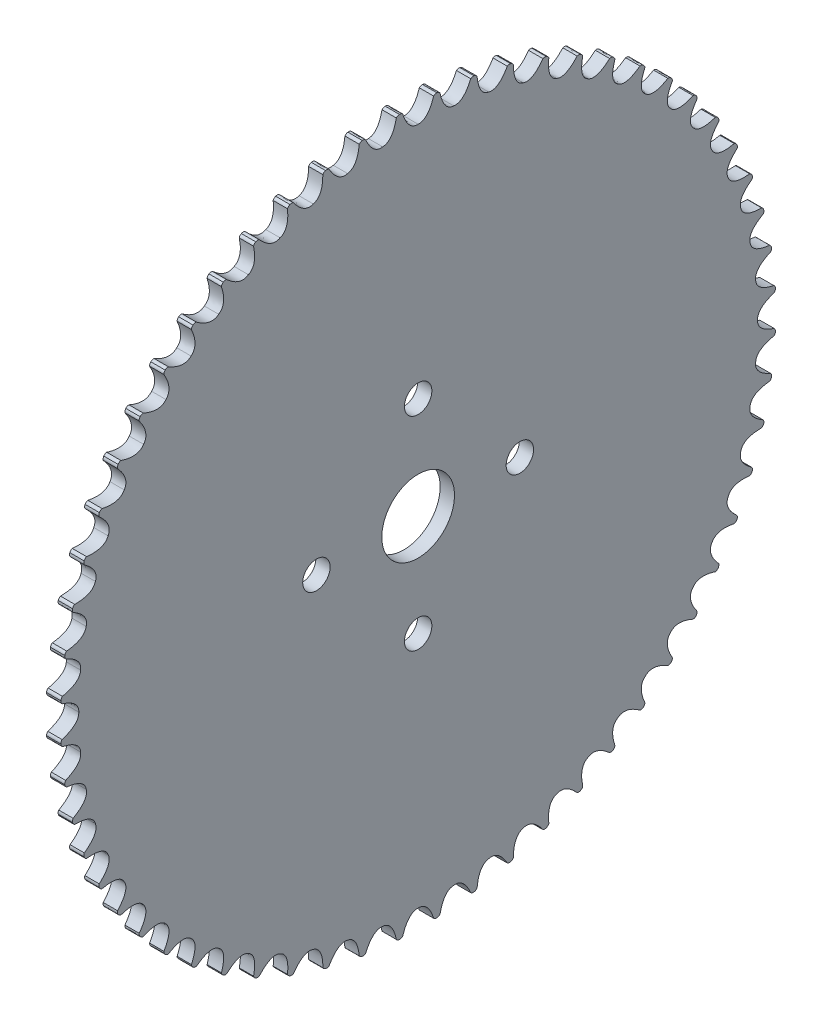
from build123d import *

# Parameters (mm, degrees)
BOSS_EXTRUDE1_DEPTH = 5
CUT_EXTRUDE3_DEPTH  = 5
SKETCH4_R           = 12.7
CUT_EXTRUDE4_DEPTH  = 5
SKETCH5_R           = 4.792551345
CUT_EXTRUDE5_DEPTH  = 5


with BuildPart() as part:
    # Sketch2 → Boss-Extrude1 (new body)
    with BuildSketch(Plane(origin=(0, 0, 0), x_dir=(0, 0, -1), z_dir=(1, 0, 0))):
        with BuildLine():
            Line((-20.522720764, 123.299339318), (-18.583323929, 123.6065096))
            add(Edge.make_bspline(
                [(-18.583323929, 123.6065096), (-17.5687314, 121.194366697), (-15.591895853, 117.421465463), (-12.393907976, 117.920157498)],
                knots=[0, 0, 0, 0, 1, 1, 1, 1], degree=3))
            add(Edge.make_bspline(
                [(-7.522004692, 124.7691011), (-8.012913231, 122.198723658), (-9.162119903, 118.097262147), (-12.393907976, 117.920157498)],
                knots=[0, 0, 0, 0, 1, 1, 1, 1], degree=3))
            Line((-7.522004692, 124.7691011), (-5.561124038, 124.8718665))
            add(Edge.make_bspline(
                [(-5.561124038, 124.8718665), (-4.804227144, 122.36688377), (-3.232596477, 118.408015302), (0, 118.569694692)],
                knots=[0, 0, 0, 0, 1, 1, 1, 1], degree=3))
            add(Edge.make_bspline(
                [(5.561124038, 124.8718665), (4.804227144, 122.36688377), (3.232596477, 118.408015302), (0, 118.569694692)],
                knots=[0, 0, 0, 0, 1, 1, 1, 1], degree=3))
            Line((5.561124038, 124.8718665), (7.522004692, 124.7691011))
            add(Edge.make_bspline(
                [(7.522004692, 124.7691011), (8.012913231, 122.198723658), (9.162119903, 118.097262147), (12.393907976, 117.920157498)],
                knots=[0, 0, 0, 0, 1, 1, 1, 1], degree=3))
            add(Edge.make_bspline(
                [(18.583323929, 123.6065096), (17.5687314, 121.194366697), (15.591895853, 117.421465463), (12.393907976, 117.920157498)],
                knots=[0, 0, 0, 0, 1, 1, 1, 1], degree=3))
            Line((18.583323929, 123.6065096), (20.522720764, 123.299339318))
            add(Edge.make_bspline(
                [(20.522720764, 123.299339318), (20.742262451, 120.691728758), (21.45645418, 116.492610675), (24.652025703, 115.978662382)],
                knots=[0, 0, 0, 0, 1, 1, 1, 1], degree=3))
            add(Edge.make_bspline(
                [(31.401921035, 120.986893915), (30.140748959, 118.694018781), (27.780367156, 115.148421476), (24.652025703, 115.978662382)],
                knots=[0, 0, 0, 0, 1, 1, 1, 1], degree=3))
            Line((31.401921035, 120.986893915), (33.298585614, 120.478684172))
            add(Edge.make_bspline(
                [(33.298585614, 120.478684172), (33.244355103, 117.862410021), (33.515707055, 113.611641782), (36.640050678, 112.766480772)],
                knots=[0, 0, 0, 0, 1, 1, 1, 1], degree=3))
            add(Edge.make_bspline(
                [(43.876472122, 117.041720501), (42.382538164, 114.893234356), (39.664470943, 111.613787288), (36.640050678, 112.766480772)],
                knots=[0, 0, 0, 0, 1, 1, 1, 1], degree=3))
            Line((43.876472122, 117.041720501), (45.709624191, 116.338039352))
            add(Edge.make_bspline(
                [(45.709624191, 116.338039352), (45.382215644, 113.741766055), (45.20775483, 109.485919967), (48.226639589, 108.318806)],
                knots=[0, 0, 0, 0, 1, 1, 1, 1], degree=3))
            add(Edge.make_bspline(
                [(55.870303399, 111.814213506), (54.159975413, 109.833655613), (51.114002485, 106.856289089), (48.226639589, 108.318806)],
                knots=[0, 0, 0, 0, 1, 1, 1, 1], degree=3))
            Line((55.870303399, 111.814213506), (57.61985856, 110.922770626))
            add(Edge.make_bspline(
                [(57.61985856, 110.922770626), (57.022859133, 108.374943499), (56.404496982, 104.160647502), (59.284847346, 102.684367722)],
                knots=[0, 0, 0, 0, 1, 1, 1, 1], degree=3))
            add(Edge.make_bspline(
                [(67.252007941, 105.361646588), (65.344024637, 103.570716355), (62.00351832, 100.928051025), (59.284847346, 102.684367722)],
                knots=[0, 0, 0, 0, 1, 1, 1, 1], degree=3))
            Line((67.252007941, 105.361646588), (68.8987977, 104.292208814))
            add(Edge.make_bspline(
                [(68.8987977, 104.292208814), (68.038748245, 101.820742382), (66.983259662, 97.694169186), (69.693517909, 95.924898023)],
                knots=[0, 0, 0, 0, 1, 1, 1, 1], degree=3))
            add(Edge.make_bspline(
                [(77.89688541, 97.754715422), (75.812151053, 96.173034655), (72.213710634, 93.894024114), (69.693517909, 95.924898023)],
                knots=[0, 0, 0, 0, 1, 1, 1, 1], degree=3))
            Line((77.89688541, 97.754715422), (79.422867196, 96.518999737))
            add(Edge.make_bspline(
                [(79.422867196, 96.518999737), (78.309190593, 94.150971905), (76.828139732, 90.157333108), (79.338611705, 88.114455068)],
                knots=[0, 0, 0, 0, 1, 1, 1, 1], degree=3))
            add(Edge.make_bspline(
                [(87.688308301, 89.076763138), (85.449663678, 87.721661062), (81.632714422, 85.831274626), (79.338611705, 88.114455068)],
                knots=[0, 0, 0, 0, 1, 1, 1, 1], degree=3))
            Line((87.688308301, 89.076763138), (89.076763138, 87.688308301))
            add(Edge.make_bspline(
                [(89.076763138, 87.688308301), (87.721661062, 85.449663678), (85.831274626, 81.632714422), (88.114455068, 79.338611705)],
                knots=[0, 0, 0, 0, 1, 1, 1, 1], degree=3))
            add(Edge.make_bspline(
                [(96.518999737, 79.422867196), (94.150971905, 78.309190593), (90.157333108, 76.828139732), (88.114455068, 79.338611705)],
                knots=[0, 0, 0, 0, 1, 1, 1, 1], degree=3))
            Line((96.518999737, 79.422867196), (97.754715422, 77.89688541))
            add(Edge.make_bspline(
                [(97.754715422, 77.89688541), (96.173034655, 75.812151053), (93.894024114, 72.213710634), (95.924898023, 69.693517909)],
                knots=[0, 0, 0, 0, 1, 1, 1, 1], degree=3))
            add(Edge.make_bspline(
                [(104.292208814, 68.8987977), (101.820742382, 68.038748245), (97.694169186, 66.983259662), (95.924898023, 69.693517909)],
                knots=[0, 0, 0, 0, 1, 1, 1, 1], degree=3))
            Line((104.292208814, 68.8987977), (105.361646588, 67.252007941))
            add(Edge.make_bspline(
                [(105.361646588, 67.252007941), (103.570716355, 65.344024637), (100.928051025, 62.00351832), (102.684367722, 59.284847346)],
                knots=[0, 0, 0, 0, 1, 1, 1, 1], degree=3))
            add(Edge.make_bspline(
                [(110.922770626, 57.61985856), (108.374943499, 57.022859133), (104.160647502, 56.404496982), (102.684367722, 59.284847346)],
                knots=[0, 0, 0, 0, 1, 1, 1, 1], degree=3))
            Line((110.922770626, 57.61985856), (111.814213506, 55.870303399))
            add(Edge.make_bspline(
                [(111.814213506, 55.870303399), (109.833655613, 54.159975413), (106.856289089, 51.114002485), (108.318806, 48.226639589)],
                knots=[0, 0, 0, 0, 1, 1, 1, 1], degree=3))
            add(Edge.make_bspline(
                [(116.338039352, 45.709624191), (113.741766055, 45.382215644), (109.485919967, 45.20775483), (108.318806, 48.226639589)],
                knots=[0, 0, 0, 0, 1, 1, 1, 1], degree=3))
            Line((116.338039352, 45.709624191), (117.041720501, 43.876472122))
            add(Edge.make_bspline(
                [(117.041720501, 43.876472122), (114.893234356, 42.382538164), (111.613787288, 39.664470943), (112.766480772, 36.640050678)],
                knots=[0, 0, 0, 0, 1, 1, 1, 1], degree=3))
            add(Edge.make_bspline(
                [(120.478684172, 33.298585614), (117.862410021, 33.244355103), (113.611641782, 33.515707055), (112.766480772, 36.640050678)],
                knots=[0, 0, 0, 0, 1, 1, 1, 1], degree=3))
            Line((120.478684172, 33.298585614), (120.986893915, 31.401921035))
            add(Edge.make_bspline(
                [(120.986893915, 31.401921035), (118.694018781, 30.140748959), (115.148421476, 27.780367156), (115.978662382, 24.652025703)],
                knots=[0, 0, 0, 0, 1, 1, 1, 1], degree=3))
            add(Edge.make_bspline(
                [(123.299339318, 20.522720764), (120.691728758, 20.742262451), (116.492610675, 21.45645418), (115.978662382, 24.652025703)],
                knots=[0, 0, 0, 0, 1, 1, 1, 1], degree=3))
            Line((123.299339318, 20.522720764), (123.6065096, 18.583323929))
            add(Edge.make_bspline(
                [(123.6065096, 18.583323929), (121.194366697, 17.5687314), (117.421465463, 15.591895853), (117.920157498, 12.393907976)],
                knots=[0, 0, 0, 0, 1, 1, 1, 1], degree=3))
            add(Edge.make_bspline(
                [(124.7691011, 7.522004692), (122.198723658, 8.012913231), (118.097262147, 9.162119903), (117.920157498, 12.393907976)],
                knots=[0, 0, 0, 0, 1, 1, 1, 1], degree=3))
            Line((124.7691011, 7.522004692), (124.8718665, 5.561124038))
            add(Edge.make_bspline(
                [(124.8718665, 5.561124038), (122.36688377, 4.804227144), (118.408015302, 3.232596477), (118.569694692, 0)],
                knots=[0, 0, 0, 0, 1, 1, 1, 1], degree=3))
            add(Edge.make_bspline(
                [(124.8718665, -5.561124038), (122.36688377, -4.804227144), (118.408015302, -3.232596477), (118.569694692, 0)],
                knots=[0, 0, 0, 0, 1, 1, 1, 1], degree=3))
            Line((124.8718665, -5.561124038), (124.7691011, -7.522004692))
            add(Edge.make_bspline(
                [(124.7691011, -7.522004692), (122.198723658, -8.012913231), (118.097262147, -9.162119903), (117.920157498, -12.393907976)],
                knots=[0, 0, 0, 0, 1, 1, 1, 1], degree=3))
            add(Edge.make_bspline(
                [(123.6065096, -18.583323929), (121.194366697, -17.5687314), (117.421465463, -15.591895853), (117.920157498, -12.393907976)],
                knots=[0, 0, 0, 0, 1, 1, 1, 1], degree=3))
            Line((123.6065096, -18.583323929), (123.299339318, -20.522720764))
            add(Edge.make_bspline(
                [(123.299339318, -20.522720764), (120.691728758, -20.742262451), (116.492610675, -21.45645418), (115.978662382, -24.652025703)],
                knots=[0, 0, 0, 0, 1, 1, 1, 1], degree=3))
            add(Edge.make_bspline(
                [(120.986893915, -31.401921035), (118.694018781, -30.140748959), (115.148421476, -27.780367156), (115.978662382, -24.652025703)],
                knots=[0, 0, 0, 0, 1, 1, 1, 1], degree=3))
            Line((120.986893915, -31.401921035), (120.478684172, -33.298585614))
            add(Edge.make_bspline(
                [(120.478684172, -33.298585614), (117.862410021, -33.244355103), (113.611641782, -33.515707055), (112.766480772, -36.640050678)],
                knots=[0, 0, 0, 0, 1, 1, 1, 1], degree=3))
            add(Edge.make_bspline(
                [(117.041720501, -43.876472122), (114.893234356, -42.382538164), (111.613787288, -39.664470943), (112.766480772, -36.640050678)],
                knots=[0, 0, 0, 0, 1, 1, 1, 1], degree=3))
            Line((117.041720501, -43.876472122), (116.338039352, -45.709624191))
            add(Edge.make_bspline(
                [(116.338039352, -45.709624191), (113.741766055, -45.382215644), (109.485919967, -45.20775483), (108.318806, -48.226639589)],
                knots=[0, 0, 0, 0, 1, 1, 1, 1], degree=3))
            add(Edge.make_bspline(
                [(111.814213506, -55.870303399), (109.833655613, -54.159975413), (106.856289089, -51.114002485), (108.318806, -48.226639589)],
                knots=[0, 0, 0, 0, 1, 1, 1, 1], degree=3))
            Line((111.814213506, -55.870303399), (110.922770626, -57.61985856))
            add(Edge.make_bspline(
                [(110.922770626, -57.61985856), (108.374943499, -57.022859133), (104.160647502, -56.404496982), (102.684367722, -59.284847346)],
                knots=[0, 0, 0, 0, 1, 1, 1, 1], degree=3))
            add(Edge.make_bspline(
                [(105.361646588, -67.252007941), (103.570716355, -65.344024637), (100.928051025, -62.00351832), (102.684367722, -59.284847346)],
                knots=[0, 0, 0, 0, 1, 1, 1, 1], degree=3))
            Line((105.361646588, -67.252007941), (104.292208814, -68.8987977))
            add(Edge.make_bspline(
                [(104.292208814, -68.8987977), (101.820742382, -68.038748245), (97.694169186, -66.983259662), (95.924898023, -69.693517909)],
                knots=[0, 0, 0, 0, 1, 1, 1, 1], degree=3))
            add(Edge.make_bspline(
                [(97.754715422, -77.89688541), (96.173034655, -75.812151053), (93.894024114, -72.213710634), (95.924898023, -69.693517909)],
                knots=[0, 0, 0, 0, 1, 1, 1, 1], degree=3))
            Line((97.754715422, -77.89688541), (96.518999737, -79.422867196))
            add(Edge.make_bspline(
                [(96.518999737, -79.422867196), (94.150971905, -78.309190593), (90.157333108, -76.828139732), (88.114455068, -79.338611705)],
                knots=[0, 0, 0, 0, 1, 1, 1, 1], degree=3))
            add(Edge.make_bspline(
                [(89.076763138, -87.688308301), (87.721661062, -85.449663678), (85.831274626, -81.632714422), (88.114455068, -79.338611705)],
                knots=[0, 0, 0, 0, 1, 1, 1, 1], degree=3))
            Line((89.076763138, -87.688308301), (87.688308301, -89.076763138))
            add(Edge.make_bspline(
                [(87.688308301, -89.076763138), (85.449663678, -87.721661062), (81.632714422, -85.831274626), (79.338611705, -88.114455068)],
                knots=[0, 0, 0, 0, 1, 1, 1, 1], degree=3))
            add(Edge.make_bspline(
                [(79.422867196, -96.518999737), (78.309190593, -94.150971905), (76.828139732, -90.157333108), (79.338611705, -88.114455068)],
                knots=[0, 0, 0, 0, 1, 1, 1, 1], degree=3))
            Line((79.422867196, -96.518999737), (77.89688541, -97.754715422))
            add(Edge.make_bspline(
                [(77.89688541, -97.754715422), (75.812151053, -96.173034655), (72.213710634, -93.894024114), (69.693517909, -95.924898023)],
                knots=[0, 0, 0, 0, 1, 1, 1, 1], degree=3))
            add(Edge.make_bspline(
                [(68.8987977, -104.292208814), (68.038748245, -101.820742382), (66.983259662, -97.694169186), (69.693517909, -95.924898023)],
                knots=[0, 0, 0, 0, 1, 1, 1, 1], degree=3))
            Line((68.8987977, -104.292208814), (67.252007941, -105.361646588))
            add(Edge.make_bspline(
                [(67.252007941, -105.361646588), (65.344024637, -103.570716355), (62.00351832, -100.928051025), (59.284847346, -102.684367722)],
                knots=[0, 0, 0, 0, 1, 1, 1, 1], degree=3))
            add(Edge.make_bspline(
                [(57.61985856, -110.922770626), (57.022859133, -108.374943499), (56.404496982, -104.160647502), (59.284847346, -102.684367722)],
                knots=[0, 0, 0, 0, 1, 1, 1, 1], degree=3))
            Line((57.61985856, -110.922770626), (55.870303399, -111.814213506))
            add(Edge.make_bspline(
                [(55.870303399, -111.814213506), (54.159975413, -109.833655613), (51.114002485, -106.856289089), (48.226639589, -108.318806)],
                knots=[0, 0, 0, 0, 1, 1, 1, 1], degree=3))
            add(Edge.make_bspline(
                [(45.709624191, -116.338039352), (45.382215644, -113.741766055), (45.20775483, -109.485919967), (48.226639589, -108.318806)],
                knots=[0, 0, 0, 0, 1, 1, 1, 1], degree=3))
            Line((45.709624191, -116.338039352), (43.876472122, -117.041720501))
            add(Edge.make_bspline(
                [(43.876472122, -117.041720501), (42.382538164, -114.893234356), (39.664470943, -111.613787288), (36.640050678, -112.766480772)],
                knots=[0, 0, 0, 0, 1, 1, 1, 1], degree=3))
            add(Edge.make_bspline(
                [(33.298585614, -120.478684172), (33.244355103, -117.862410021), (33.515707055, -113.611641782), (36.640050678, -112.766480772)],
                knots=[0, 0, 0, 0, 1, 1, 1, 1], degree=3))
            Line((33.298585614, -120.478684172), (31.401921035, -120.986893915))
            add(Edge.make_bspline(
                [(31.401921035, -120.986893915), (30.140748959, -118.694018781), (27.780367156, -115.148421476), (24.652025703, -115.978662382)],
                knots=[0, 0, 0, 0, 1, 1, 1, 1], degree=3))
            add(Edge.make_bspline(
                [(20.522720764, -123.299339318), (20.742262451, -120.691728758), (21.45645418, -116.492610675), (24.652025703, -115.978662382)],
                knots=[0, 0, 0, 0, 1, 1, 1, 1], degree=3))
            Line((20.522720764, -123.299339318), (18.583323929, -123.6065096))
            add(Edge.make_bspline(
                [(18.583323929, -123.6065096), (17.5687314, -121.194366697), (15.591895853, -117.421465463), (12.393907976, -117.920157498)],
                knots=[0, 0, 0, 0, 1, 1, 1, 1], degree=3))
            add(Edge.make_bspline(
                [(7.522004692, -124.7691011), (8.012913231, -122.198723658), (9.162119903, -118.097262147), (12.393907976, -117.920157498)],
                knots=[0, 0, 0, 0, 1, 1, 1, 1], degree=3))
            Line((7.522004692, -124.7691011), (5.561124038, -124.8718665))
            add(Edge.make_bspline(
                [(5.561124038, -124.8718665), (4.804227143, -122.36688377), (3.232596477, -118.408015302), (0, -118.569694692)],
                knots=[0, 0, 0, 0, 1, 1, 1, 1], degree=3))
            add(Edge.make_bspline(
                [(-5.561124038, -124.8718665), (-4.804227144, -122.36688377), (-3.232596477, -118.408015302), (0, -118.569694692)],
                knots=[0, 0, 0, 0, 1, 1, 1, 1], degree=3))
            Line((-5.561124038, -124.8718665), (-7.522004692, -124.7691011))
            add(Edge.make_bspline(
                [(-7.522004692, -124.7691011), (-8.012913231, -122.198723658), (-9.162119903, -118.097262147), (-12.393907976, -117.920157498)],
                knots=[0, 0, 0, 0, 1, 1, 1, 1], degree=3))
            add(Edge.make_bspline(
                [(-18.583323929, -123.6065096), (-17.5687314, -121.194366697), (-15.591895853, -117.421465463), (-12.393907976, -117.920157498)],
                knots=[0, 0, 0, 0, 1, 1, 1, 1], degree=3))
            Line((-18.583323929, -123.6065096), (-20.522720764, -123.299339318))
            add(Edge.make_bspline(
                [(-20.522720764, -123.299339318), (-20.742262451, -120.691728758), (-21.45645418, -116.492610675), (-24.652025703, -115.978662382)],
                knots=[0, 0, 0, 0, 1, 1, 1, 1], degree=3))
            add(Edge.make_bspline(
                [(-31.401921035, -120.986893915), (-30.140748959, -118.694018781), (-27.780367156, -115.148421476), (-24.652025703, -115.978662382)],
                knots=[0, 0, 0, 0, 1, 1, 1, 1], degree=3))
            Line((-31.401921035, -120.986893915), (-33.298585614, -120.478684172))
            add(Edge.make_bspline(
                [(-33.298585614, -120.478684172), (-33.244355103, -117.862410021), (-33.515707055, -113.611641782), (-36.640050678, -112.766480772)],
                knots=[0, 0, 0, 0, 1, 1, 1, 1], degree=3))
            add(Edge.make_bspline(
                [(-43.876472122, -117.041720501), (-42.382538164, -114.893234356), (-39.664470943, -111.613787288), (-36.640050678, -112.766480772)],
                knots=[0, 0, 0, 0, 1, 1, 1, 1], degree=3))
            Line((-43.876472122, -117.041720501), (-45.709624191, -116.338039352))
            add(Edge.make_bspline(
                [(-45.709624191, -116.338039352), (-45.382215644, -113.741766055), (-45.20775483, -109.485919967), (-48.226639589, -108.318806)],
                knots=[0, 0, 0, 0, 1, 1, 1, 1], degree=3))
            add(Edge.make_bspline(
                [(-55.870303399, -111.814213506), (-54.159975413, -109.833655613), (-51.114002485, -106.856289089), (-48.226639589, -108.318806)],
                knots=[0, 0, 0, 0, 1, 1, 1, 1], degree=3))
            Line((-55.870303399, -111.814213506), (-57.61985856, -110.922770626))
            add(Edge.make_bspline(
                [(-57.61985856, -110.922770626), (-57.022859133, -108.374943499), (-56.404496982, -104.160647502), (-59.284847346, -102.684367722)],
                knots=[0, 0, 0, 0, 1, 1, 1, 1], degree=3))
            add(Edge.make_bspline(
                [(-67.252007941, -105.361646588), (-65.344024637, -103.570716355), (-62.00351832, -100.928051025), (-59.284847346, -102.684367722)],
                knots=[0, 0, 0, 0, 1, 1, 1, 1], degree=3))
            Line((-67.252007941, -105.361646588), (-68.8987977, -104.292208814))
            add(Edge.make_bspline(
                [(-68.8987977, -104.292208814), (-68.038748245, -101.820742382), (-66.983259662, -97.694169186), (-69.693517909, -95.924898023)],
                knots=[0, 0, 0, 0, 1, 1, 1, 1], degree=3))
            add(Edge.make_bspline(
                [(-77.89688541, -97.754715422), (-75.812151053, -96.173034655), (-72.213710634, -93.894024114), (-69.693517909, -95.924898023)],
                knots=[0, 0, 0, 0, 1, 1, 1, 1], degree=3))
            Line((-77.89688541, -97.754715422), (-79.422867196, -96.518999737))
            add(Edge.make_bspline(
                [(-79.422867196, -96.518999737), (-78.309190593, -94.150971905), (-76.828139732, -90.157333108), (-79.338611705, -88.114455068)],
                knots=[0, 0, 0, 0, 1, 1, 1, 1], degree=3))
            add(Edge.make_bspline(
                [(-87.688308301, -89.076763138), (-85.449663678, -87.721661062), (-81.632714422, -85.831274626), (-79.338611705, -88.114455068)],
                knots=[0, 0, 0, 0, 1, 1, 1, 1], degree=3))
            Line((-87.688308301, -89.076763138), (-89.076763138, -87.688308301))
            add(Edge.make_bspline(
                [(-89.076763138, -87.688308301), (-87.721661062, -85.449663678), (-85.831274626, -81.632714422), (-88.114455068, -79.338611705)],
                knots=[0, 0, 0, 0, 1, 1, 1, 1], degree=3))
            add(Edge.make_bspline(
                [(-96.518999737, -79.422867196), (-94.150971905, -78.309190593), (-90.157333108, -76.828139732), (-88.114455068, -79.338611705)],
                knots=[0, 0, 0, 0, 1, 1, 1, 1], degree=3))
            Line((-96.518999737, -79.422867196), (-97.754715422, -77.89688541))
            add(Edge.make_bspline(
                [(-97.754715422, -77.89688541), (-96.173034655, -75.812151053), (-93.894024114, -72.213710634), (-95.924898023, -69.693517909)],
                knots=[0, 0, 0, 0, 1, 1, 1, 1], degree=3))
            add(Edge.make_bspline(
                [(-104.292208814, -68.8987977), (-101.820742382, -68.038748245), (-97.694169186, -66.983259662), (-95.924898023, -69.693517909)],
                knots=[0, 0, 0, 0, 1, 1, 1, 1], degree=3))
            Line((-104.292208814, -68.8987977), (-105.361646588, -67.252007941))
            add(Edge.make_bspline(
                [(-105.361646588, -67.252007941), (-103.570716355, -65.344024637), (-100.928051025, -62.00351832), (-102.684367722, -59.284847346)],
                knots=[0, 0, 0, 0, 1, 1, 1, 1], degree=3))
            add(Edge.make_bspline(
                [(-110.922770626, -57.61985856), (-108.374943499, -57.022859133), (-104.160647502, -56.404496982), (-102.684367722, -59.284847346)],
                knots=[0, 0, 0, 0, 1, 1, 1, 1], degree=3))
            Line((-110.922770626, -57.61985856), (-111.814213506, -55.870303399))
            add(Edge.make_bspline(
                [(-111.814213506, -55.870303399), (-109.833655613, -54.159975413), (-106.856289089, -51.114002485), (-108.318806, -48.226639589)],
                knots=[0, 0, 0, 0, 1, 1, 1, 1], degree=3))
            add(Edge.make_bspline(
                [(-116.338039352, -45.709624191), (-113.741766055, -45.382215644), (-109.485919967, -45.20775483), (-108.318806, -48.226639589)],
                knots=[0, 0, 0, 0, 1, 1, 1, 1], degree=3))
            Line((-116.338039352, -45.709624191), (-117.041720501, -43.876472122))
            add(Edge.make_bspline(
                [(-117.041720501, -43.876472122), (-114.893234356, -42.382538164), (-111.613787288, -39.664470943), (-112.766480772, -36.640050678)],
                knots=[0, 0, 0, 0, 1, 1, 1, 1], degree=3))
            add(Edge.make_bspline(
                [(-120.478684172, -33.298585614), (-117.862410021, -33.244355103), (-113.611641782, -33.515707055), (-112.766480772, -36.640050678)],
                knots=[0, 0, 0, 0, 1, 1, 1, 1], degree=3))
            Line((-120.478684172, -33.298585614), (-120.986893915, -31.401921035))
            add(Edge.make_bspline(
                [(-120.986893915, -31.401921035), (-118.694018781, -30.140748959), (-115.148421476, -27.780367156), (-115.978662382, -24.652025703)],
                knots=[0, 0, 0, 0, 1, 1, 1, 1], degree=3))
            add(Edge.make_bspline(
                [(-123.299339318, -20.522720764), (-120.691728758, -20.742262451), (-116.492610675, -21.45645418), (-115.978662382, -24.652025703)],
                knots=[0, 0, 0, 0, 1, 1, 1, 1], degree=3))
            Line((-123.299339318, -20.522720764), (-123.6065096, -18.583323929))
            add(Edge.make_bspline(
                [(-123.6065096, -18.583323929), (-121.194366697, -17.5687314), (-117.421465463, -15.591895853), (-117.920157498, -12.393907976)],
                knots=[0, 0, 0, 0, 1, 1, 1, 1], degree=3))
            add(Edge.make_bspline(
                [(-124.7691011, -7.522004692), (-122.198723658, -8.012913231), (-118.097262147, -9.162119903), (-117.920157498, -12.393907976)],
                knots=[0, 0, 0, 0, 1, 1, 1, 1], degree=3))
            Line((-124.7691011, -7.522004692), (-124.8718665, -5.561124038))
            add(Edge.make_bspline(
                [(-124.8718665, -5.561124038), (-122.36688377, -4.804227143), (-118.408015302, -3.232596477), (-118.569694692, 0)],
                knots=[0, 0, 0, 0, 1, 1, 1, 1], degree=3))
            add(Edge.make_bspline(
                [(-124.8718665, 5.561124038), (-122.36688377, 4.804227144), (-118.408015302, 3.232596477), (-118.569694692, 0)],
                knots=[0, 0, 0, 0, 1, 1, 1, 1], degree=3))
            Line((-124.8718665, 5.561124038), (-124.7691011, 7.522004692))
            add(Edge.make_bspline(
                [(-124.7691011, 7.522004692), (-122.198723658, 8.012913231), (-118.097262147, 9.162119903), (-117.920157498, 12.393907976)],
                knots=[0, 0, 0, 0, 1, 1, 1, 1], degree=3))
            add(Edge.make_bspline(
                [(-123.6065096, 18.583323929), (-121.194366697, 17.5687314), (-117.421465463, 15.591895853), (-117.920157498, 12.393907976)],
                knots=[0, 0, 0, 0, 1, 1, 1, 1], degree=3))
            Line((-123.6065096, 18.583323929), (-123.299339318, 20.522720764))
            add(Edge.make_bspline(
                [(-123.299339318, 20.522720764), (-120.691728758, 20.742262451), (-116.492610675, 21.45645418), (-115.978662382, 24.652025703)],
                knots=[0, 0, 0, 0, 1, 1, 1, 1], degree=3))
            add(Edge.make_bspline(
                [(-120.986893915, 31.401921035), (-118.694018781, 30.140748959), (-115.148421476, 27.780367156), (-115.978662382, 24.652025703)],
                knots=[0, 0, 0, 0, 1, 1, 1, 1], degree=3))
            Line((-120.986893915, 31.401921035), (-120.478684172, 33.298585614))
            add(Edge.make_bspline(
                [(-120.478684172, 33.298585614), (-117.862410021, 33.244355103), (-113.611641782, 33.515707055), (-112.766480772, 36.640050678)],
                knots=[0, 0, 0, 0, 1, 1, 1, 1], degree=3))
            add(Edge.make_bspline(
                [(-117.041720501, 43.876472122), (-114.893234356, 42.382538164), (-111.613787288, 39.664470943), (-112.766480772, 36.640050678)],
                knots=[0, 0, 0, 0, 1, 1, 1, 1], degree=3))
            Line((-117.041720501, 43.876472122), (-116.338039352, 45.709624191))
            add(Edge.make_bspline(
                [(-116.338039352, 45.709624191), (-113.741766055, 45.382215644), (-109.485919967, 45.20775483), (-108.318806, 48.226639589)],
                knots=[0, 0, 0, 0, 1, 1, 1, 1], degree=3))
            add(Edge.make_bspline(
                [(-111.814213506, 55.870303399), (-109.833655613, 54.159975413), (-106.856289089, 51.114002485), (-108.318806, 48.226639589)],
                knots=[0, 0, 0, 0, 1, 1, 1, 1], degree=3))
            Line((-111.814213506, 55.870303399), (-110.922770626, 57.61985856))
            add(Edge.make_bspline(
                [(-110.922770626, 57.61985856), (-108.374943499, 57.022859133), (-104.160647502, 56.404496982), (-102.684367722, 59.284847346)],
                knots=[0, 0, 0, 0, 1, 1, 1, 1], degree=3))
            add(Edge.make_bspline(
                [(-105.361646588, 67.252007941), (-103.570716355, 65.344024637), (-100.928051025, 62.00351832), (-102.684367722, 59.284847346)],
                knots=[0, 0, 0, 0, 1, 1, 1, 1], degree=3))
            Line((-105.361646588, 67.252007941), (-104.292208814, 68.8987977))
            add(Edge.make_bspline(
                [(-104.292208814, 68.8987977), (-101.820742382, 68.038748245), (-97.694169186, 66.983259662), (-95.924898023, 69.693517909)],
                knots=[0, 0, 0, 0, 1, 1, 1, 1], degree=3))
            add(Edge.make_bspline(
                [(-97.754715422, 77.89688541), (-96.173034655, 75.812151053), (-93.894024114, 72.213710634), (-95.924898023, 69.693517909)],
                knots=[0, 0, 0, 0, 1, 1, 1, 1], degree=3))
            Line((-97.754715422, 77.89688541), (-96.518999737, 79.422867196))
            add(Edge.make_bspline(
                [(-96.518999737, 79.422867196), (-94.150971905, 78.309190593), (-90.157333108, 76.828139732), (-88.114455068, 79.338611705)],
                knots=[0, 0, 0, 0, 1, 1, 1, 1], degree=3))
            add(Edge.make_bspline(
                [(-89.076763138, 87.688308301), (-87.721661062, 85.449663678), (-85.831274626, 81.632714422), (-88.114455068, 79.338611705)],
                knots=[0, 0, 0, 0, 1, 1, 1, 1], degree=3))
            Line((-89.076763138, 87.688308301), (-87.688308301, 89.076763138))
            add(Edge.make_bspline(
                [(-87.688308301, 89.076763138), (-85.449663678, 87.721661062), (-81.632714422, 85.831274626), (-79.338611705, 88.114455068)],
                knots=[0, 0, 0, 0, 1, 1, 1, 1], degree=3))
            add(Edge.make_bspline(
                [(-79.422867196, 96.518999737), (-78.309190593, 94.150971905), (-76.828139732, 90.157333108), (-79.338611705, 88.114455068)],
                knots=[0, 0, 0, 0, 1, 1, 1, 1], degree=3))
            Line((-79.422867196, 96.518999737), (-77.89688541, 97.754715422))
            add(Edge.make_bspline(
                [(-77.89688541, 97.754715422), (-75.812151053, 96.173034655), (-72.213710634, 93.894024114), (-69.693517909, 95.924898023)],
                knots=[0, 0, 0, 0, 1, 1, 1, 1], degree=3))
            add(Edge.make_bspline(
                [(-68.8987977, 104.292208814), (-68.038748245, 101.820742382), (-66.983259662, 97.694169186), (-69.693517909, 95.924898023)],
                knots=[0, 0, 0, 0, 1, 1, 1, 1], degree=3))
            Line((-68.8987977, 104.292208814), (-67.252007941, 105.361646588))
            add(Edge.make_bspline(
                [(-67.252007941, 105.361646588), (-65.344024637, 103.570716355), (-62.00351832, 100.928051025), (-59.284847346, 102.684367722)],
                knots=[0, 0, 0, 0, 1, 1, 1, 1], degree=3))
            add(Edge.make_bspline(
                [(-57.61985856, 110.922770626), (-57.022859133, 108.374943499), (-56.404496982, 104.160647502), (-59.284847346, 102.684367722)],
                knots=[0, 0, 0, 0, 1, 1, 1, 1], degree=3))
            Line((-57.61985856, 110.922770626), (-55.870303399, 111.814213506))
            add(Edge.make_bspline(
                [(-55.870303399, 111.814213506), (-54.159975413, 109.833655613), (-51.114002485, 106.856289089), (-48.226639589, 108.318806)],
                knots=[0, 0, 0, 0, 1, 1, 1, 1], degree=3))
            add(Edge.make_bspline(
                [(-45.709624191, 116.338039352), (-45.382215644, 113.741766055), (-45.20775483, 109.485919967), (-48.226639589, 108.318806)],
                knots=[0, 0, 0, 0, 1, 1, 1, 1], degree=3))
            Line((-45.709624191, 116.338039352), (-43.876472122, 117.041720501))
            add(Edge.make_bspline(
                [(-43.876472122, 117.041720501), (-42.382538164, 114.893234356), (-39.664470943, 111.613787288), (-36.640050678, 112.766480772)],
                knots=[0, 0, 0, 0, 1, 1, 1, 1], degree=3))
            add(Edge.make_bspline(
                [(-33.298585614, 120.478684172), (-33.244355103, 117.862410021), (-33.515707055, 113.611641782), (-36.640050678, 112.766480772)],
                knots=[0, 0, 0, 0, 1, 1, 1, 1], degree=3))
            Line((-33.298585614, 120.478684172), (-31.401921035, 120.986893915))
            add(Edge.make_bspline(
                [(-31.401921035, 120.986893915), (-30.140748959, 118.694018781), (-27.780367156, 115.148421476), (-24.652025703, 115.978662382)],
                knots=[0, 0, 0, 0, 1, 1, 1, 1], degree=3))
            add(Edge.make_bspline(
                [(-20.522720764, 123.299339318), (-20.742262451, 120.691728758), (-21.45645418, 116.492610675), (-24.652025703, 115.978662382)],
                knots=[0, 0, 0, 0, 1, 1, 1, 1], degree=3))
        make_face()
    extrude(amount=BOSS_EXTRUDE1_DEPTH)

    # Sketch3 → Cut-Extrude3 (cut)
    with BuildSketch(Plane.ZY):
        with BuildLine():
            Line((-97.427193758, 77.38077369), (-97.80226207, 77.971809865))
            Line((-97.80226207, 77.971809865), (-96.602172417, 79.453797165))
            Line((-96.602172417, 79.453797165), (-95.946070713, 79.209808326))
            add(Edge.make_bspline(
                [(-95.946070713, 79.209808326), (-96.634225052, 79.246528044), (-97.13685758, 78.659876303)],
                knots=[0, 0, 0, 1, 1, 1], degree=2))
            add(Edge.make_bspline(
                [(-97.427193758, 77.38077369), (-97.606186395, 78.046255747), (-97.13685758, 78.659876303)],
                knots=[0, 0, 0, 1, 1, 1], degree=2))
        make_face()
        with BuildLine():
            Line((-87.767792291, 89.116217582), (-87.140788559, 88.804984036))
            add(Edge.make_bspline(
                [(-87.140788559, 88.804984036), (-87.821334861, 88.913434316), (-88.382535719, 88.382535719)],
                knots=[0, 0, 0, 1, 1, 1], degree=2))
            add(Edge.make_bspline(
                [(-88.804984036, 87.140788559), (-88.913434316, 87.821334861), (-88.382535719, 88.382535719)],
                knots=[0, 0, 0, 1, 1, 1], degree=2))
            Line((-88.804984036, 87.140788559), (-89.116217582, 87.767792291))
            Line((-89.116217582, 87.767792291), (-87.767792291, 89.116217582))
        make_face()
        with BuildLine():
            Line((-77.971809865, 97.80226207), (-77.38077369, 97.427193758))
            add(Edge.make_bspline(
                [(-77.38077369, 97.427193758), (-78.046255747, 97.606186395), (-78.659876303, 97.13685758)],
                knots=[0, 0, 0, 1, 1, 1], degree=2))
            add(Edge.make_bspline(
                [(-79.209808326, 95.946070713), (-79.246528044, 96.634225052), (-78.659876303, 97.13685758)],
                knots=[0, 0, 0, 1, 1, 1], degree=2))
            Line((-79.209808326, 95.946070713), (-79.453797165, 96.602172417))
            Line((-79.453797165, 96.602172417), (-77.971809865, 97.80226207))
        make_face()
        with BuildLine():
            Line((-67.321551974, 105.416764509), (-66.772958871, 104.981970757))
            add(Edge.make_bspline(
                [(-66.772958871, 104.981970757), (-67.416085522, 105.22954467), (-68.075402821, 104.826927701)],
                knots=[0, 0, 0, 1, 1, 1], degree=2))
            add(Edge.make_bspline(
                [(-68.74679338, 103.700147639), (-68.711380228, 104.388370452), (-68.075402821, 104.826927701)],
                knots=[0, 0, 0, 1, 1, 1], degree=2))
            Line((-68.74679338, 103.700147639), (-68.92086432, 104.378158928))
            Line((-68.92086432, 104.378158928), (-67.321551974, 105.416764509))
        make_face()
        with BuildLine():
            Line((-55.933705072, 111.876298816), (-55.433565542, 111.386543315))
            add(Edge.make_bspline(
                [(-55.433565542, 111.386543315), (-56.047290557, 111.699986033), (-56.745080979, 111.368492066)],
                knots=[0, 0, 0, 1, 1, 1], degree=2))
            add(Edge.make_bspline(
                [(-57.530574179, 110.318064046), (-57.423416152, 110.998815021), (-56.745080979, 111.368492066)],
                knots=[0, 0, 0, 1, 1, 1], degree=2))
            Line((-57.530574179, 110.318064046), (-57.632820063, 111.010556486))
            Line((-57.632820063, 111.010556486), (-55.933705072, 111.876298816))
        make_face()
        with BuildLine():
            Line((-43.933036792, 117.110092981), (-43.486830468, 116.570741596))
            add(Edge.make_bspline(
                [(-43.486830468, 116.570741596), (-44.064429748, 116.946618974), (-44.793048156, 116.689879926)],
                knots=[0, 0, 0, 1, 1, 1], degree=2))
            add(Edge.make_bspline(
                [(-45.684037969, 115.727312659), (-45.506309111, 116.393133344), (-44.793048156, 116.689879926)],
                knots=[0, 0, 0, 1, 1, 1], degree=2))
            Line((-45.684037969, 115.727312659), (-45.713338568, 116.426699158))
            Line((-45.713338568, 116.426699158), (-43.933036792, 117.110092981))
        make_face()
        with BuildLine():
            Line((-31.451028967, 121.060804461), (-31.06364458, 120.477766438))
            add(Edge.make_bspline(
                [(-31.06364458, 120.477766438), (-31.598789826, 120.911960286), (-32.350253324, 120.732789044)],
                knots=[0, 0, 0, 1, 1, 1], degree=2))
            add(Edge.make_bspline(
                [(-33.336977879, 119.868628616), (-33.090625425, 120.512224142), (-32.350253324, 120.732789044)],
                knots=[0, 0, 0, 1, 1, 1], degree=2))
            Line((-33.336977879, 119.868628616), (-33.29301217, 120.567246549))
            Line((-33.29301217, 120.567246549), (-31.451028967, 121.060804461))
        make_face()
        with BuildLine():
            Line((-18.624437087, 123.685148433), (-18.300118901, 123.064811659))
            add(Edge.make_bspline(
                [(-18.300118901, 123.064811659), (-18.786946949, 123.552564858), (-19.553022347, 123.452924459)],
                knots=[0, 0, 0, 1, 1, 1], degree=2))
            add(Edge.make_bspline(
                [(-20.624670883, 122.696638794), (-20.312393922, 123.310957793), (-19.553022347, 123.452924459)],
                knots=[0, 0, 0, 1, 1, 1], degree=2))
            Line((-20.624670883, 122.696638794), (-20.507920564, 123.386833957))
            Line((-20.507920564, 123.386833957), (-18.624437087, 123.685148433))
        make_face()
        with BuildLine():
            Line((-5.593791977, 124.954372037), (-5.33609329, 124.30353305))
            add(Edge.make_bspline(
                [(-5.33609329, 124.30353305), (-5.769270351, 124.839501674), (-6.541564365, 124.8204838)],
                knots=[0, 0, 0, 1, 1, 1], degree=2))
            add(Edge.make_bspline(
                [(-7.686395676, 124.180358921), (-7.311615581, 124.758670786), (-6.541564365, 124.8204838)],
                knots=[0, 0, 0, 1, 1, 1], degree=2))
            Line((-7.686395676, 124.180358921), (-7.498139888, 124.854569392))
            Line((-7.498139888, 124.854569392), (-5.593791977, 124.954372037))
        make_face()
        with BuildLine():
            Line((7.498139888, 124.854569392), (7.686395676, 124.180358921))
            add(Edge.make_bspline(
                [(7.686395676, 124.180358921), (7.311615581, 124.758670786), (6.541564365, 124.8204838)],
                knots=[0, 0, 0, 1, 1, 1], degree=2))
            add(Edge.make_bspline(
                [(5.33609329, 124.30353305), (5.769270351, 124.839501674), (6.541564365, 124.8204838)],
                knots=[0, 0, 0, 1, 1, 1], degree=2))
            Line((5.33609329, 124.30353305), (5.593791977, 124.954372037))
            Line((5.593791977, 124.954372037), (7.498139888, 124.854569392))
        make_face()
        with BuildLine():
            Line((20.507920564, 123.386833957), (20.624670883, 122.696638794))
            add(Edge.make_bspline(
                [(20.624670883, 122.696638794), (20.312393922, 123.310957793), (19.553022347, 123.452924459)],
                knots=[0, 0, 0, 1, 1, 1], degree=2))
            add(Edge.make_bspline(
                [(18.300118901, 123.064811659), (18.786946949, 123.552564858), (19.553022347, 123.452924459)],
                knots=[0, 0, 0, 1, 1, 1], degree=2))
            Line((18.300118901, 123.064811659), (18.624437087, 123.685148433))
            Line((18.624437087, 123.685148433), (20.507920564, 123.386833957))
        make_face()
        with BuildLine():
            Line((33.29301217, 120.567246549), (33.336977879, 119.868628616))
            add(Edge.make_bspline(
                [(33.336977879, 119.868628616), (33.090625425, 120.512224142), (32.350253324, 120.732789044)],
                knots=[0, 0, 0, 1, 1, 1], degree=2))
            add(Edge.make_bspline(
                [(31.06364458, 120.477766438), (31.598789826, 120.911960286), (32.350253324, 120.732789044)],
                knots=[0, 0, 0, 1, 1, 1], degree=2))
            Line((31.06364458, 120.477766438), (31.451028967, 121.060804461))
            Line((31.451028967, 121.060804461), (33.29301217, 120.567246549))
        make_face()
        with BuildLine():
            Line((45.713338568, 116.426699158), (45.684037969, 115.727312659))
            add(Edge.make_bspline(
                [(45.684037969, 115.727312659), (45.506309111, 116.393133344), (44.793048156, 116.689879926)],
                knots=[0, 0, 0, 1, 1, 1], degree=2))
            add(Edge.make_bspline(
                [(43.486830468, 116.570741596), (44.064429748, 116.946618974), (44.793048156, 116.689879926)],
                knots=[0, 0, 0, 1, 1, 1], degree=2))
            Line((43.486830468, 116.570741596), (43.933036792, 117.110092981))
            Line((43.933036792, 117.110092981), (45.713338568, 116.426699158))
        make_face()
        with BuildLine():
            Line((57.632820063, 111.010556486), (57.530574179, 110.318064046))
            add(Edge.make_bspline(
                [(57.530574179, 110.318064046), (57.423416152, 110.998815021), (56.745080979, 111.368492066)],
                knots=[0, 0, 0, 1, 1, 1], degree=2))
            add(Edge.make_bspline(
                [(55.433565542, 111.386543315), (56.047290557, 111.699986033), (56.745080979, 111.368492066)],
                knots=[0, 0, 0, 1, 1, 1], degree=2))
            Line((55.433565542, 111.386543315), (55.933705072, 111.876298816))
            Line((55.933705072, 111.876298816), (57.632820063, 111.010556486))
        make_face()
        with BuildLine():
            Line((68.92086432, 104.378158928), (68.74679338, 103.700147639))
            add(Edge.make_bspline(
                [(68.74679338, 103.700147639), (68.711380228, 104.388370452), (68.075402821, 104.826927701)],
                knots=[0, 0, 0, 1, 1, 1], degree=2))
            add(Edge.make_bspline(
                [(66.772958871, 104.981970757), (67.416085522, 105.22954467), (68.075402821, 104.826927701)],
                knots=[0, 0, 0, 1, 1, 1], degree=2))
            Line((66.772958871, 104.981970757), (67.321551974, 105.416764509))
            Line((67.321551974, 105.416764509), (68.92086432, 104.378158928))
        make_face()
        with BuildLine():
            Line((79.453797165, 96.602172417), (79.209808326, 95.946070713))
            add(Edge.make_bspline(
                [(79.209808326, 95.946070713), (79.246528044, 96.634225052), (78.659876303, 97.13685758)],
                knots=[0, 0, 0, 1, 1, 1], degree=2))
            add(Edge.make_bspline(
                [(77.38077369, 97.427193758), (78.046255747, 97.606186395), (78.659876303, 97.13685758)],
                knots=[0, 0, 0, 1, 1, 1], degree=2))
            Line((77.38077369, 97.427193758), (77.971809865, 97.802262071))
            Line((77.971809865, 97.802262071), (79.453797165, 96.602172417))
        make_face()
        with BuildLine():
            Line((89.116217582, 87.767792291), (88.804984036, 87.140788559))
            add(Edge.make_bspline(
                [(88.804984036, 87.140788559), (88.913434316, 87.821334861), (88.382535719, 88.382535719)],
                knots=[0, 0, 0, 1, 1, 1], degree=2))
            add(Edge.make_bspline(
                [(87.140788559, 88.804984036), (87.821334861, 88.913434316), (88.382535719, 88.382535719)],
                knots=[0, 0, 0, 1, 1, 1], degree=2))
            Line((87.140788559, 88.804984036), (87.767792291, 89.116217582))
            Line((87.767792291, 89.116217582), (89.116217582, 87.767792291))
        make_face()
        with BuildLine():
            Line((97.80226207, 77.971809865), (97.427193758, 77.38077369))
            add(Edge.make_bspline(
                [(97.427193758, 77.38077369), (97.606186395, 78.046255747), (97.13685758, 78.659876303)],
                knots=[0, 0, 0, 1, 1, 1], degree=2))
            add(Edge.make_bspline(
                [(95.946070713, 79.209808326), (96.634225052, 79.246528044), (97.13685758, 78.659876303)],
                knots=[0, 0, 0, 1, 1, 1], degree=2))
            Line((95.946070713, 79.209808326), (96.602172417, 79.453797165))
            Line((96.602172417, 79.453797165), (97.80226207, 77.971809865))
        make_face()
        with BuildLine():
            Line((105.416764509, 67.321551974), (104.981970757, 66.772958871))
            add(Edge.make_bspline(
                [(104.981970757, 66.772958871), (105.22954467, 67.416085522), (104.826927701, 68.075402821)],
                knots=[0, 0, 0, 1, 1, 1], degree=2))
            add(Edge.make_bspline(
                [(103.700147639, 68.74679338), (104.388370452, 68.711380228), (104.826927701, 68.075402821)],
                knots=[0, 0, 0, 1, 1, 1], degree=2))
            Line((103.700147639, 68.74679338), (104.378158928, 68.92086432))
            Line((104.378158928, 68.92086432), (105.416764509, 67.321551974))
        make_face()
        with BuildLine():
            Line((111.876298816, 55.933705072), (111.386543315, 55.433565542))
            add(Edge.make_bspline(
                [(111.386543315, 55.433565542), (111.699986033, 56.047290557), (111.368492066, 56.745080979)],
                knots=[0, 0, 0, 1, 1, 1], degree=2))
            add(Edge.make_bspline(
                [(110.318064046, 57.530574179), (110.998815021, 57.423416152), (111.368492066, 56.745080979)],
                knots=[0, 0, 0, 1, 1, 1], degree=2))
            Line((110.318064046, 57.530574179), (111.010556486, 57.632820063))
            Line((111.010556486, 57.632820063), (111.876298816, 55.933705072))
        make_face()
        with BuildLine():
            Line((117.110092981, 43.933036792), (116.570741596, 43.486830468))
            add(Edge.make_bspline(
                [(116.570741596, 43.486830468), (116.946618974, 44.064429748), (116.689879926, 44.793048156)],
                knots=[0, 0, 0, 1, 1, 1], degree=2))
            add(Edge.make_bspline(
                [(115.727312659, 45.684037969), (116.393133344, 45.506309111), (116.689879926, 44.793048156)],
                knots=[0, 0, 0, 1, 1, 1], degree=2))
            Line((115.727312659, 45.684037969), (116.426699158, 45.713338568))
            Line((116.426699158, 45.713338568), (117.110092981, 43.933036792))
        make_face()
        with BuildLine():
            Line((121.060804461, 31.451028967), (120.477766438, 31.06364458))
            add(Edge.make_bspline(
                [(120.477766438, 31.06364458), (120.911960286, 31.598789826), (120.732789044, 32.350253324)],
                knots=[0, 0, 0, 1, 1, 1], degree=2))
            add(Edge.make_bspline(
                [(119.868628616, 33.336977879), (120.512224142, 33.090625425), (120.732789044, 32.350253324)],
                knots=[0, 0, 0, 1, 1, 1], degree=2))
            Line((119.868628616, 33.336977879), (120.567246549, 33.29301217))
            Line((120.567246549, 33.29301217), (121.060804461, 31.451028967))
        make_face()
        with BuildLine():
            Line((123.685148433, 18.624437087), (123.064811659, 18.300118901))
            add(Edge.make_bspline(
                [(123.064811659, 18.300118901), (123.552564858, 18.786946949), (123.452924459, 19.553022347)],
                knots=[0, 0, 0, 1, 1, 1], degree=2))
            add(Edge.make_bspline(
                [(122.696638794, 20.624670883), (123.310957793, 20.312393922), (123.452924459, 19.553022347)],
                knots=[0, 0, 0, 1, 1, 1], degree=2))
            Line((122.696638794, 20.624670883), (123.386833957, 20.507920564))
            Line((123.386833957, 20.507920564), (123.685148433, 18.624437087))
        make_face()
        with BuildLine():
            Line((124.954372037, 5.593791977), (124.30353305, 5.33609329))
            add(Edge.make_bspline(
                [(124.30353305, 5.33609329), (124.839501674, 5.769270351), (124.8204838, 6.541564365)],
                knots=[0, 0, 0, 1, 1, 1], degree=2))
            add(Edge.make_bspline(
                [(124.180358921, 7.686395676), (124.758670785, 7.311615581), (124.8204838, 6.541564365)],
                knots=[0, 0, 0, 1, 1, 1], degree=2))
            Line((124.180358921, 7.686395676), (124.854569392, 7.498139888))
            Line((124.854569392, 7.498139888), (124.954372037, 5.593791977))
        make_face()
        with BuildLine():
            Line((124.854569392, -7.498139888), (124.180358921, -7.686395676))
            add(Edge.make_bspline(
                [(124.180358921, -7.686395676), (124.758670786, -7.311615581), (124.8204838, -6.541564365)],
                knots=[0, 0, 0, 1, 1, 1], degree=2))
            add(Edge.make_bspline(
                [(124.30353305, -5.33609329), (124.839501674, -5.769270351), (124.8204838, -6.541564365)],
                knots=[0, 0, 0, 1, 1, 1], degree=2))
            Line((124.30353305, -5.33609329), (124.954372037, -5.593791977))
            Line((124.954372037, -5.593791977), (124.854569392, -7.498139888))
        make_face()
        with BuildLine():
            Line((123.386833957, -20.507920564), (122.696638794, -20.624670883))
            add(Edge.make_bspline(
                [(122.696638794, -20.624670883), (123.310957793, -20.312393922), (123.452924459, -19.553022347)],
                knots=[0, 0, 0, 1, 1, 1], degree=2))
            add(Edge.make_bspline(
                [(123.064811659, -18.300118901), (123.552564858, -18.786946949), (123.452924459, -19.553022347)],
                knots=[0, 0, 0, 1, 1, 1], degree=2))
            Line((123.064811659, -18.300118901), (123.685148433, -18.624437087))
            Line((123.685148433, -18.624437087), (123.386833957, -20.507920564))
        make_face()
        with BuildLine():
            Line((120.567246549, -33.29301217), (119.868628616, -33.336977879))
            add(Edge.make_bspline(
                [(119.868628616, -33.336977879), (120.512224142, -33.090625425), (120.732789044, -32.350253324)],
                knots=[0, 0, 0, 1, 1, 1], degree=2))
            add(Edge.make_bspline(
                [(120.477766438, -31.06364458), (120.911960286, -31.598789826), (120.732789044, -32.350253324)],
                knots=[0, 0, 0, 1, 1, 1], degree=2))
            Line((120.477766438, -31.06364458), (121.060804461, -31.451028967))
            Line((121.060804461, -31.451028967), (120.567246549, -33.29301217))
        make_face()
        with BuildLine():
            Line((116.426699158, -45.713338568), (115.727312659, -45.684037969))
            add(Edge.make_bspline(
                [(115.727312659, -45.684037969), (116.393133344, -45.506309111), (116.689879926, -44.793048156)],
                knots=[0, 0, 0, 1, 1, 1], degree=2))
            add(Edge.make_bspline(
                [(116.570741596, -43.486830468), (116.946618974, -44.064429748), (116.689879926, -44.793048156)],
                knots=[0, 0, 0, 1, 1, 1], degree=2))
            Line((116.570741596, -43.486830468), (117.110092981, -43.933036792))
            Line((117.110092981, -43.933036792), (116.426699158, -45.713338568))
        make_face()
        with BuildLine():
            Line((111.010556486, -57.632820063), (110.318064046, -57.530574179))
            add(Edge.make_bspline(
                [(110.318064046, -57.530574179), (110.998815021, -57.423416152), (111.368492066, -56.745080979)],
                knots=[0, 0, 0, 1, 1, 1], degree=2))
            add(Edge.make_bspline(
                [(111.386543315, -55.433565542), (111.699986033, -56.047290557), (111.368492066, -56.745080979)],
                knots=[0, 0, 0, 1, 1, 1], degree=2))
            Line((111.386543315, -55.433565542), (111.876298816, -55.933705072))
            Line((111.876298816, -55.933705072), (111.010556486, -57.632820063))
        make_face()
        with BuildLine():
            Line((104.378158928, -68.92086432), (103.700147639, -68.74679338))
            add(Edge.make_bspline(
                [(103.700147639, -68.74679338), (104.388370452, -68.711380228), (104.826927701, -68.075402821)],
                knots=[0, 0, 0, 1, 1, 1], degree=2))
            add(Edge.make_bspline(
                [(104.981970757, -66.772958871), (105.22954467, -67.416085522), (104.826927701, -68.075402821)],
                knots=[0, 0, 0, 1, 1, 1], degree=2))
            Line((104.981970757, -66.772958871), (105.416764509, -67.321551974))
            Line((105.416764509, -67.321551974), (104.378158928, -68.92086432))
        make_face()
        with BuildLine():
            Line((96.602172417, -79.453797165), (95.946070713, -79.209808326))
            add(Edge.make_bspline(
                [(95.946070713, -79.209808326), (96.634225052, -79.246528044), (97.13685758, -78.659876303)],
                knots=[0, 0, 0, 1, 1, 1], degree=2))
            add(Edge.make_bspline(
                [(97.427193758, -77.38077369), (97.606186395, -78.046255747), (97.13685758, -78.659876303)],
                knots=[0, 0, 0, 1, 1, 1], degree=2))
            Line((97.427193758, -77.38077369), (97.80226207, -77.971809865))
            Line((97.80226207, -77.971809865), (96.602172417, -79.453797165))
        make_face()
        with BuildLine():
            Line((87.767792291, -89.116217582), (87.140788559, -88.804984036))
            add(Edge.make_bspline(
                [(87.140788559, -88.804984036), (87.821334861, -88.913434316), (88.382535719, -88.382535719)],
                knots=[0, 0, 0, 1, 1, 1], degree=2))
            add(Edge.make_bspline(
                [(88.804984036, -87.140788559), (88.913434316, -87.821334861), (88.382535719, -88.382535719)],
                knots=[0, 0, 0, 1, 1, 1], degree=2))
            Line((88.804984036, -87.140788559), (89.116217582, -87.767792291))
            Line((89.116217582, -87.767792291), (87.767792291, -89.116217582))
        make_face()
        with BuildLine():
            Line((77.971809865, -97.80226207), (77.38077369, -97.427193758))
            add(Edge.make_bspline(
                [(77.38077369, -97.427193758), (78.046255747, -97.606186395), (78.659876303, -97.13685758)],
                knots=[0, 0, 0, 1, 1, 1], degree=2))
            add(Edge.make_bspline(
                [(79.209808326, -95.946070713), (79.246528044, -96.634225052), (78.659876303, -97.13685758)],
                knots=[0, 0, 0, 1, 1, 1], degree=2))
            Line((79.209808326, -95.946070713), (79.453797165, -96.602172417))
            Line((79.453797165, -96.602172417), (77.971809865, -97.80226207))
        make_face()
        with BuildLine():
            Line((67.321551974, -105.416764509), (66.772958871, -104.981970757))
            add(Edge.make_bspline(
                [(66.772958871, -104.981970757), (67.416085522, -105.22954467), (68.075402821, -104.826927701)],
                knots=[0, 0, 0, 1, 1, 1], degree=2))
            add(Edge.make_bspline(
                [(68.74679338, -103.700147639), (68.711380228, -104.388370452), (68.075402821, -104.826927701)],
                knots=[0, 0, 0, 1, 1, 1], degree=2))
            Line((68.74679338, -103.700147639), (68.92086432, -104.378158928))
            Line((68.92086432, -104.378158928), (67.321551974, -105.416764509))
        make_face()
        with BuildLine():
            Line((55.933705072, -111.876298816), (55.433565542, -111.386543315))
            add(Edge.make_bspline(
                [(55.433565542, -111.386543315), (56.047290557, -111.699986033), (56.745080979, -111.368492066)],
                knots=[0, 0, 0, 1, 1, 1], degree=2))
            add(Edge.make_bspline(
                [(57.530574179, -110.318064046), (57.423416152, -110.998815021), (56.745080979, -111.368492066)],
                knots=[0, 0, 0, 1, 1, 1], degree=2))
            Line((57.530574179, -110.318064046), (57.632820063, -111.010556486))
            Line((57.632820063, -111.010556486), (55.933705072, -111.876298816))
        make_face()
        with BuildLine():
            Line((43.933036792, -117.110092981), (43.486830468, -116.570741596))
            add(Edge.make_bspline(
                [(43.486830468, -116.570741596), (44.064429748, -116.946618974), (44.793048156, -116.689879926)],
                knots=[0, 0, 0, 1, 1, 1], degree=2))
            add(Edge.make_bspline(
                [(45.684037969, -115.727312659), (45.506309111, -116.393133344), (44.793048156, -116.689879926)],
                knots=[0, 0, 0, 1, 1, 1], degree=2))
            Line((45.684037969, -115.727312659), (45.713338568, -116.426699158))
            Line((45.713338568, -116.426699158), (43.933036792, -117.110092981))
        make_face()
        with BuildLine():
            Line((31.451028967, -121.060804461), (31.06364458, -120.477766438))
            add(Edge.make_bspline(
                [(31.06364458, -120.477766438), (31.598789826, -120.911960286), (32.350253324, -120.732789044)],
                knots=[0, 0, 0, 1, 1, 1], degree=2))
            add(Edge.make_bspline(
                [(33.336977879, -119.868628616), (33.090625425, -120.512224142), (32.350253324, -120.732789044)],
                knots=[0, 0, 0, 1, 1, 1], degree=2))
            Line((33.336977879, -119.868628616), (33.29301217, -120.567246549))
            Line((33.29301217, -120.567246549), (31.451028967, -121.060804461))
        make_face()
        with BuildLine():
            Line((18.624437087, -123.685148433), (18.300118901, -123.064811659))
            add(Edge.make_bspline(
                [(18.300118901, -123.064811659), (18.786946949, -123.552564858), (19.553022347, -123.452924459)],
                knots=[0, 0, 0, 1, 1, 1], degree=2))
            add(Edge.make_bspline(
                [(20.624670883, -122.696638794), (20.312393922, -123.310957793), (19.553022347, -123.452924459)],
                knots=[0, 0, 0, 1, 1, 1], degree=2))
            Line((20.624670883, -122.696638794), (20.507920564, -123.386833957))
            Line((20.507920564, -123.386833957), (18.624437087, -123.685148433))
        make_face()
        with BuildLine():
            Line((5.593791977, -124.954372037), (5.33609329, -124.30353305))
            add(Edge.make_bspline(
                [(5.33609329, -124.30353305), (5.769270351, -124.839501674), (6.541564365, -124.8204838)],
                knots=[0, 0, 0, 1, 1, 1], degree=2))
            add(Edge.make_bspline(
                [(7.686395676, -124.180358921), (7.311615581, -124.758670785), (6.541564365, -124.8204838)],
                knots=[0, 0, 0, 1, 1, 1], degree=2))
            Line((7.686395676, -124.180358921), (7.498139888, -124.854569392))
            Line((7.498139888, -124.854569392), (5.593791977, -124.954372037))
        make_face()
        with BuildLine():
            Line((-7.498139888, -124.854569392), (-7.686395676, -124.180358921))
            add(Edge.make_bspline(
                [(-7.686395676, -124.180358921), (-7.311615581, -124.758670786), (-6.541564365, -124.8204838)],
                knots=[0, 0, 0, 1, 1, 1], degree=2))
            add(Edge.make_bspline(
                [(-5.33609329, -124.30353305), (-5.769270351, -124.839501674), (-6.541564365, -124.8204838)],
                knots=[0, 0, 0, 1, 1, 1], degree=2))
            Line((-5.33609329, -124.30353305), (-5.593791977, -124.954372037))
            Line((-5.593791977, -124.954372037), (-7.498139888, -124.854569392))
        make_face()
        with BuildLine():
            Line((-20.507920564, -123.386833957), (-20.624670883, -122.696638794))
            add(Edge.make_bspline(
                [(-20.624670883, -122.696638794), (-20.312393922, -123.310957793), (-19.553022347, -123.452924459)],
                knots=[0, 0, 0, 1, 1, 1], degree=2))
            add(Edge.make_bspline(
                [(-18.300118901, -123.064811659), (-18.786946949, -123.552564858), (-19.553022347, -123.452924459)],
                knots=[0, 0, 0, 1, 1, 1], degree=2))
            Line((-18.300118901, -123.064811659), (-18.624437087, -123.685148433))
            Line((-18.624437087, -123.685148433), (-20.507920564, -123.386833957))
        make_face()
        with BuildLine():
            Line((-33.29301217, -120.567246549), (-33.336977879, -119.868628616))
            add(Edge.make_bspline(
                [(-33.336977879, -119.868628616), (-33.090625425, -120.512224142), (-32.350253324, -120.732789044)],
                knots=[0, 0, 0, 1, 1, 1], degree=2))
            add(Edge.make_bspline(
                [(-31.06364458, -120.477766438), (-31.598789826, -120.911960286), (-32.350253324, -120.732789044)],
                knots=[0, 0, 0, 1, 1, 1], degree=2))
            Line((-31.06364458, -120.477766438), (-31.451028967, -121.060804461))
            Line((-31.451028967, -121.060804461), (-33.29301217, -120.567246549))
        make_face()
        with BuildLine():
            Line((-45.713338568, -116.426699158), (-45.684037969, -115.727312659))
            add(Edge.make_bspline(
                [(-45.684037969, -115.727312659), (-45.506309111, -116.393133344), (-44.793048156, -116.689879926)],
                knots=[0, 0, 0, 1, 1, 1], degree=2))
            add(Edge.make_bspline(
                [(-43.486830468, -116.570741596), (-44.064429748, -116.946618974), (-44.793048156, -116.689879926)],
                knots=[0, 0, 0, 1, 1, 1], degree=2))
            Line((-43.486830468, -116.570741596), (-43.933036792, -117.110092981))
            Line((-43.933036792, -117.110092981), (-45.713338568, -116.426699158))
        make_face()
        with BuildLine():
            Line((-57.632820063, -111.010556486), (-57.530574179, -110.318064046))
            add(Edge.make_bspline(
                [(-57.530574179, -110.318064046), (-57.423416152, -110.998815021), (-56.745080979, -111.368492066)],
                knots=[0, 0, 0, 1, 1, 1], degree=2))
            add(Edge.make_bspline(
                [(-55.433565542, -111.386543315), (-56.047290557, -111.699986033), (-56.745080979, -111.368492066)],
                knots=[0, 0, 0, 1, 1, 1], degree=2))
            Line((-55.433565542, -111.386543315), (-55.933705072, -111.876298816))
            Line((-55.933705072, -111.876298816), (-57.632820063, -111.010556486))
        make_face()
        with BuildLine():
            Line((-68.92086432, -104.378158928), (-68.74679338, -103.700147639))
            add(Edge.make_bspline(
                [(-68.74679338, -103.700147639), (-68.711380228, -104.388370452), (-68.075402821, -104.826927701)],
                knots=[0, 0, 0, 1, 1, 1], degree=2))
            add(Edge.make_bspline(
                [(-66.772958871, -104.981970757), (-67.416085522, -105.22954467), (-68.075402821, -104.826927701)],
                knots=[0, 0, 0, 1, 1, 1], degree=2))
            Line((-66.772958871, -104.981970757), (-67.321551974, -105.416764509))
            Line((-67.321551974, -105.416764509), (-68.92086432, -104.378158928))
        make_face()
        with BuildLine():
            Line((-79.453797165, -96.602172417), (-79.209808326, -95.946070713))
            add(Edge.make_bspline(
                [(-79.209808326, -95.946070713), (-79.246528044, -96.634225052), (-78.659876303, -97.13685758)],
                knots=[0, 0, 0, 1, 1, 1], degree=2))
            add(Edge.make_bspline(
                [(-77.38077369, -97.427193758), (-78.046255747, -97.606186395), (-78.659876303, -97.13685758)],
                knots=[0, 0, 0, 1, 1, 1], degree=2))
            Line((-77.38077369, -97.427193758), (-77.971809865, -97.80226207))
            Line((-77.971809865, -97.80226207), (-79.453797165, -96.602172417))
        make_face()
        with BuildLine():
            Line((-89.116217582, -87.767792291), (-88.804984036, -87.140788559))
            add(Edge.make_bspline(
                [(-88.804984036, -87.140788559), (-88.913434316, -87.821334861), (-88.382535719, -88.382535719)],
                knots=[0, 0, 0, 1, 1, 1], degree=2))
            add(Edge.make_bspline(
                [(-87.140788559, -88.804984036), (-87.821334861, -88.913434316), (-88.382535719, -88.382535719)],
                knots=[0, 0, 0, 1, 1, 1], degree=2))
            Line((-87.140788559, -88.804984036), (-87.767792291, -89.116217582))
            Line((-87.767792291, -89.116217582), (-89.116217582, -87.767792291))
        make_face()
        with BuildLine():
            Line((-97.80226207, -77.971809865), (-97.427193758, -77.38077369))
            add(Edge.make_bspline(
                [(-97.427193758, -77.38077369), (-97.606186395, -78.046255747), (-97.13685758, -78.659876303)],
                knots=[0, 0, 0, 1, 1, 1], degree=2))
            add(Edge.make_bspline(
                [(-95.946070713, -79.209808326), (-96.634225052, -79.246528044), (-97.13685758, -78.659876303)],
                knots=[0, 0, 0, 1, 1, 1], degree=2))
            Line((-95.946070713, -79.209808326), (-96.602172417, -79.453797165))
            Line((-96.602172417, -79.453797165), (-97.80226207, -77.971809865))
        make_face()
        with BuildLine():
            Line((-105.416764509, -67.321551974), (-104.981970757, -66.772958871))
            add(Edge.make_bspline(
                [(-104.981970757, -66.772958871), (-105.22954467, -67.416085522), (-104.826927701, -68.075402821)],
                knots=[0, 0, 0, 1, 1, 1], degree=2))
            add(Edge.make_bspline(
                [(-103.700147639, -68.74679338), (-104.388370452, -68.711380228), (-104.826927701, -68.075402821)],
                knots=[0, 0, 0, 1, 1, 1], degree=2))
            Line((-103.700147639, -68.74679338), (-104.378158928, -68.92086432))
            Line((-104.378158928, -68.92086432), (-105.416764509, -67.321551974))
        make_face()
        with BuildLine():
            Line((-111.876298816, -55.933705072), (-111.386543315, -55.433565542))
            add(Edge.make_bspline(
                [(-111.386543315, -55.433565542), (-111.699986033, -56.047290557), (-111.368492066, -56.745080979)],
                knots=[0, 0, 0, 1, 1, 1], degree=2))
            add(Edge.make_bspline(
                [(-110.318064046, -57.530574179), (-110.998815021, -57.423416152), (-111.368492066, -56.745080979)],
                knots=[0, 0, 0, 1, 1, 1], degree=2))
            Line((-110.318064046, -57.530574179), (-111.010556486, -57.632820063))
            Line((-111.010556486, -57.632820063), (-111.876298816, -55.933705072))
        make_face()
        with BuildLine():
            Line((-117.110092981, -43.933036792), (-116.570741596, -43.486830468))
            add(Edge.make_bspline(
                [(-116.570741596, -43.486830468), (-116.946618974, -44.064429748), (-116.689879926, -44.793048156)],
                knots=[0, 0, 0, 1, 1, 1], degree=2))
            add(Edge.make_bspline(
                [(-115.727312659, -45.684037969), (-116.393133344, -45.506309111), (-116.689879926, -44.793048156)],
                knots=[0, 0, 0, 1, 1, 1], degree=2))
            Line((-115.727312659, -45.684037969), (-116.426699158, -45.713338568))
            Line((-116.426699158, -45.713338568), (-117.110092981, -43.933036792))
        make_face()
        with BuildLine():
            Line((-121.060804461, -31.451028967), (-120.477766438, -31.06364458))
            add(Edge.make_bspline(
                [(-120.477766438, -31.06364458), (-120.911960286, -31.598789826), (-120.732789044, -32.350253324)],
                knots=[0, 0, 0, 1, 1, 1], degree=2))
            add(Edge.make_bspline(
                [(-119.868628616, -33.336977879), (-120.512224142, -33.090625425), (-120.732789044, -32.350253324)],
                knots=[0, 0, 0, 1, 1, 1], degree=2))
            Line((-119.868628616, -33.336977879), (-120.567246549, -33.29301217))
            Line((-120.567246549, -33.29301217), (-121.060804461, -31.451028967))
        make_face()
        with BuildLine():
            Line((-123.685148433, -18.624437087), (-123.064811659, -18.300118901))
            add(Edge.make_bspline(
                [(-123.064811659, -18.300118901), (-123.552564858, -18.786946949), (-123.452924459, -19.553022347)],
                knots=[0, 0, 0, 1, 1, 1], degree=2))
            add(Edge.make_bspline(
                [(-122.696638794, -20.624670883), (-123.310957793, -20.312393922), (-123.452924459, -19.553022347)],
                knots=[0, 0, 0, 1, 1, 1], degree=2))
            Line((-122.696638794, -20.624670883), (-123.386833957, -20.507920564))
            Line((-123.386833957, -20.507920564), (-123.685148433, -18.624437087))
        make_face()
        with BuildLine():
            Line((-124.954372037, -5.593791977), (-124.30353305, -5.33609329))
            add(Edge.make_bspline(
                [(-124.30353305, -5.33609329), (-124.839501674, -5.769270351), (-124.8204838, -6.541564365)],
                knots=[0, 0, 0, 1, 1, 1], degree=2))
            add(Edge.make_bspline(
                [(-124.180358921, -7.686395676), (-124.758670786, -7.311615581), (-124.8204838, -6.541564365)],
                knots=[0, 0, 0, 1, 1, 1], degree=2))
            Line((-124.180358921, -7.686395676), (-124.854569392, -7.498139888))
            Line((-124.854569392, -7.498139888), (-124.954372037, -5.593791977))
        make_face()
        with BuildLine():
            Line((-124.854569392, 7.498139888), (-124.180358921, 7.686395676))
            add(Edge.make_bspline(
                [(-124.180358921, 7.686395676), (-124.758670786, 7.311615581), (-124.8204838, 6.541564365)],
                knots=[0, 0, 0, 1, 1, 1], degree=2))
            add(Edge.make_bspline(
                [(-124.30353305, 5.33609329), (-124.839501674, 5.769270351), (-124.8204838, 6.541564365)],
                knots=[0, 0, 0, 1, 1, 1], degree=2))
            Line((-124.30353305, 5.33609329), (-124.954372037, 5.593791977))
            Line((-124.954372037, 5.593791977), (-124.854569392, 7.498139888))
        make_face()
        with BuildLine():
            Line((-123.386833957, 20.507920564), (-122.696638794, 20.624670883))
            add(Edge.make_bspline(
                [(-122.696638794, 20.624670883), (-123.310957793, 20.312393922), (-123.452924459, 19.553022347)],
                knots=[0, 0, 0, 1, 1, 1], degree=2))
            add(Edge.make_bspline(
                [(-123.064811659, 18.300118901), (-123.552564858, 18.786946949), (-123.452924459, 19.553022347)],
                knots=[0, 0, 0, 1, 1, 1], degree=2))
            Line((-123.064811659, 18.300118901), (-123.685148433, 18.624437087))
            Line((-123.685148433, 18.624437087), (-123.386833957, 20.507920564))
        make_face()
        with BuildLine():
            Line((-120.567246549, 33.29301217), (-119.868628616, 33.336977879))
            add(Edge.make_bspline(
                [(-119.868628616, 33.336977879), (-120.512224142, 33.090625425), (-120.732789044, 32.350253324)],
                knots=[0, 0, 0, 1, 1, 1], degree=2))
            add(Edge.make_bspline(
                [(-120.477766438, 31.06364458), (-120.911960286, 31.598789826), (-120.732789044, 32.350253324)],
                knots=[0, 0, 0, 1, 1, 1], degree=2))
            Line((-120.477766438, 31.06364458), (-121.060804461, 31.451028967))
            Line((-121.060804461, 31.451028967), (-120.567246549, 33.29301217))
        make_face()
        with BuildLine():
            Line((-116.426699158, 45.713338568), (-115.727312659, 45.684037969))
            add(Edge.make_bspline(
                [(-115.727312659, 45.684037969), (-116.393133344, 45.506309111), (-116.689879926, 44.793048156)],
                knots=[0, 0, 0, 1, 1, 1], degree=2))
            add(Edge.make_bspline(
                [(-116.570741596, 43.486830468), (-116.946618974, 44.064429748), (-116.689879926, 44.793048156)],
                knots=[0, 0, 0, 1, 1, 1], degree=2))
            Line((-116.570741596, 43.486830468), (-117.110092981, 43.933036792))
            Line((-117.110092981, 43.933036792), (-116.426699158, 45.713338568))
        make_face()
        with BuildLine():
            Line((-111.010556486, 57.632820063), (-110.318064046, 57.530574179))
            add(Edge.make_bspline(
                [(-110.318064046, 57.530574179), (-110.998815021, 57.423416152), (-111.368492066, 56.745080979)],
                knots=[0, 0, 0, 1, 1, 1], degree=2))
            add(Edge.make_bspline(
                [(-111.386543315, 55.433565542), (-111.699986033, 56.047290557), (-111.368492066, 56.745080979)],
                knots=[0, 0, 0, 1, 1, 1], degree=2))
            Line((-111.386543315, 55.433565542), (-111.876298816, 55.933705072))
            Line((-111.876298816, 55.933705072), (-111.010556486, 57.632820063))
        make_face()
        with BuildLine():
            Line((-104.378158928, 68.92086432), (-103.700147639, 68.74679338))
            add(Edge.make_bspline(
                [(-103.700147639, 68.74679338), (-104.388370452, 68.711380228), (-104.826927701, 68.075402821)],
                knots=[0, 0, 0, 1, 1, 1], degree=2))
            add(Edge.make_bspline(
                [(-104.981970757, 66.772958871), (-105.22954467, 67.416085522), (-104.826927701, 68.075402821)],
                knots=[0, 0, 0, 1, 1, 1], degree=2))
            Line((-104.981970757, 66.772958871), (-105.416764509, 67.321551974))
            Line((-105.416764509, 67.321551974), (-104.378158928, 68.92086432))
        make_face()
    extrude(amount=-CUT_EXTRUDE3_DEPTH, mode=Mode.SUBTRACT)

    # Sketch4 → Cut-Extrude4 (cut)
    with BuildSketch(Plane.ZY):
        Circle(SKETCH4_R)
    extrude(amount=-CUT_EXTRUDE4_DEPTH, mode=Mode.SUBTRACT)

    # Sketch5 → Cut-Extrude5 (cut)
    with BuildSketch(Plane.ZY):
        with Locations((0, 35.535685667)):
            Circle(SKETCH5_R)
        with Locations((-35.535685667, 0)):
            Circle(SKETCH5_R)
        with Locations((35.535685667, 0)):
            Circle(SKETCH5_R)
        with Locations((0, -35.535685667)):
            Circle(SKETCH5_R)
    extrude(amount=-CUT_EXTRUDE5_DEPTH, mode=Mode.SUBTRACT)


solid = part.part
